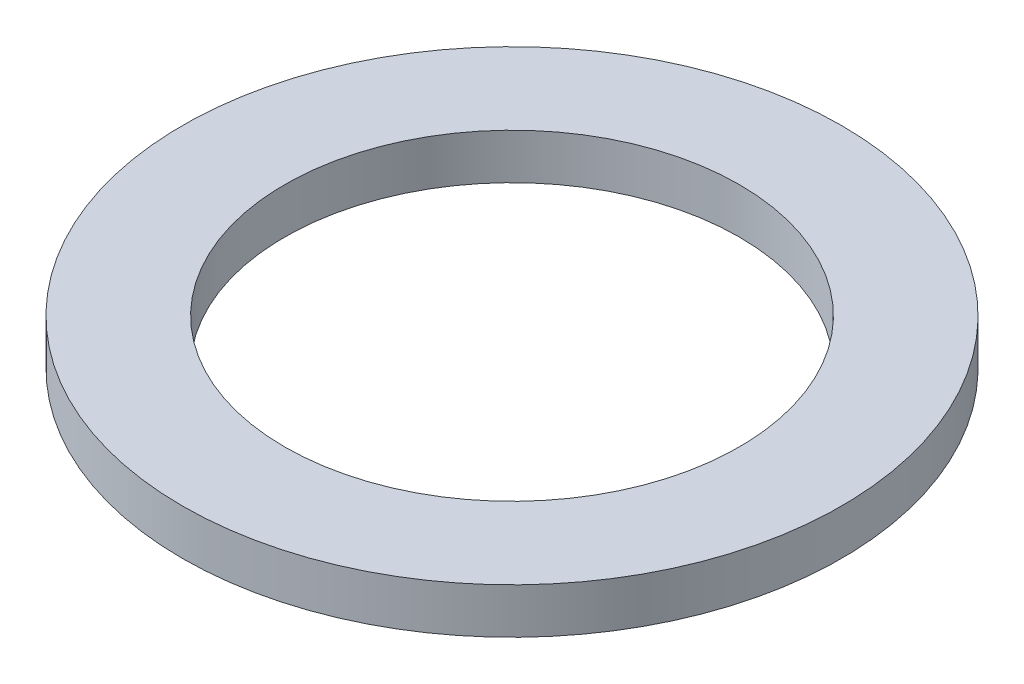
from build123d import *

# Parameters (mm, degrees)
SKETCH1_R           = 72.5
BOSS_EXTRUDE1_DEPTH = 10
SKETCH2_R           = 50
CUT_EXTRUDE1_DEPTH  = 104.01698889


with BuildPart() as part:
    # Sketch1 → Boss-Extrude1 (new body)
    with BuildSketch(Plane(origin=(0, 0, 0), x_dir=(1, 0, 0), z_dir=(0, 1, 0))):
        Circle(SKETCH1_R)
    extrude(amount=BOSS_EXTRUDE1_DEPTH)

    # Sketch2 → Cut-Extrude1 (cut, through all)
    with BuildSketch(Plane(origin=(0, 0, 0), x_dir=(1, 0, 0), z_dir=(0, 1, 0))):
        Circle(SKETCH2_R)
    extrude(amount=CUT_EXTRUDE1_DEPTH, mode=Mode.SUBTRACT)


solid = part.part
